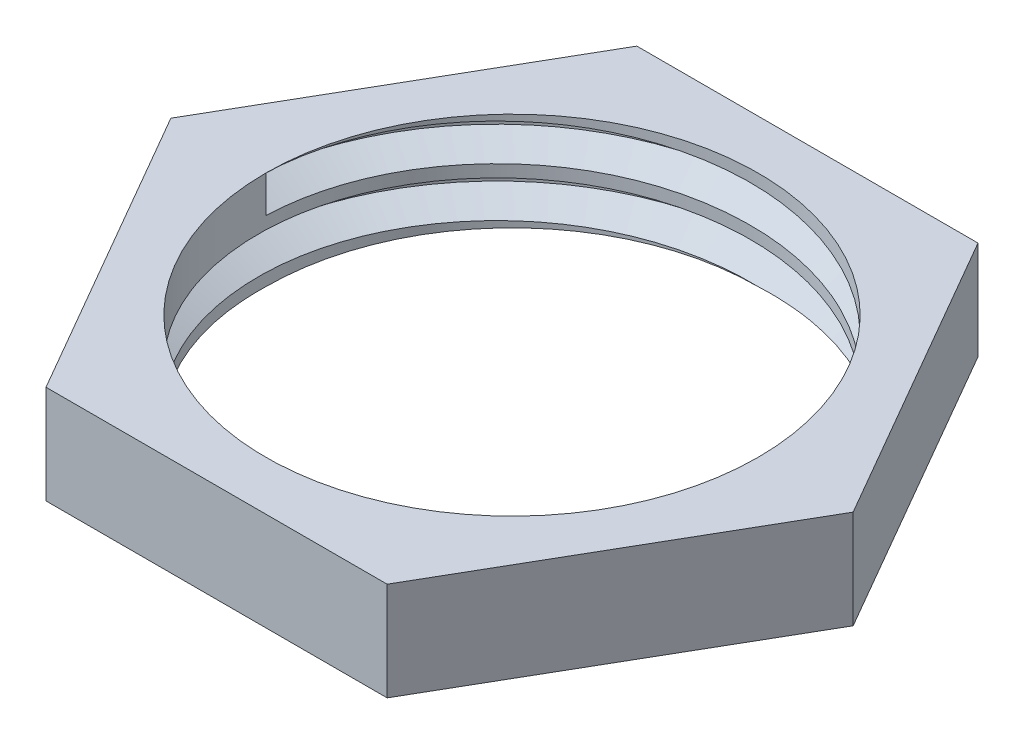
from build123d import *

# Parameters (mm, degrees)
SKETCH1_R           = 5
BOSS_EXTRUDE1_DEPTH = 2
THREAD1_PITCH       = 1


with BuildPart() as part:
    # Sketch1 → Boss-Extrude1 (new body)
    with BuildSketch(Plane(origin=(0, 0, 0), x_dir=(1, 0, 0), z_dir=(0, 1, 0))):
        Polygon((6.92820323, 0), (3.464101615, 6), (-3.464101615, 6), (-6.92820323, 0), (-3.464101615, -6), (3.464101615, -6), align=None)
        with Locations(Location((0, 0, 0), (0, 0, 270))):
            Circle(SKETCH1_R, mode=Mode.SUBTRACT)
    extrude(amount=BOSS_EXTRUDE1_DEPTH)

    # Thread1: the profile of Thread Profile1 profile screwed along a right-hand helix of 2 turns, 8 arcs to a turn; built about Z, then put on its axis
    thread1_z = Axis((0, 0, 0), (0, 0, 1))
    thread1_corners = [(4.9997, 0, -0.000173205), (5.541265875, 0, 0.312499999), (5.541265875, 0, 0.437499999), (4.9997, 0, 0.750173202)]
    with BuildLine(mode=Mode.PRIVATE) as thread1_profile:
        Line(thread1_corners[0], thread1_corners[1])
        Line(thread1_corners[1], thread1_corners[2])
        Line(thread1_corners[2], thread1_corners[3])
        Line(thread1_corners[3], thread1_corners[0])
    thread1_cap = Face(thread1_profile.wire())
    thread1_turn_angles = [0, 22.5, 45, 67.5, 90, 112.5, 135, 157.5, 180, 202.5, 225, 247.5, 270, 292.5, 315, 337.5, 360]
    thread1_turn_weights = [1, 0.9238795325112867, 1, 0.9238795325112867, 1, 0.9238795325112867, 1, 0.9238795325112867, 1, 0.9238795325112867, 1, 0.9238795325112867, 1, 0.9238795325112867, 1, 0.9238795325112867, 1]
    thread1_turn_rails = [Edge.make_bspline([Vector(p[0], p[1], 0).rotate(thread1_z, thread1_turn_angles[k]) / thread1_turn_weights[k] + Vector(0, 0, p[2] + THREAD1_PITCH * thread1_turn_angles[k] / 360) for k in range(17)], [0, 0, 0, 1, 1, 2, 2, 3, 3, 4, 4, 5, 5, 6, 6, 7, 7, 8, 8, 8], 2, thread1_turn_weights) for p in thread1_corners]
    thread1_turn_sides = [Face.make_surface_from_curves(thread1_turn_rails[p[0]], thread1_turn_rails[p[1]]) for p in [(0, 1), (1, 2), (2, 3), (3, 0)]]
    thread1 = Plane(origin=(0, 2, 0), x_dir=(-1, 0, 0), z_dir=(0, -1, 0)) * Solid(Shell([*[p.moved(Location((0, 0, THREAD1_PITCH * i))) for i in range(2) for p in thread1_turn_sides], thread1_cap, thread1_cap.rotate(thread1_z, 720).moved(Location((0, 0, THREAD1_PITCH * 720 / 360)))]))
    add(thread1, mode=Mode.SUBTRACT)


solid = part.part
